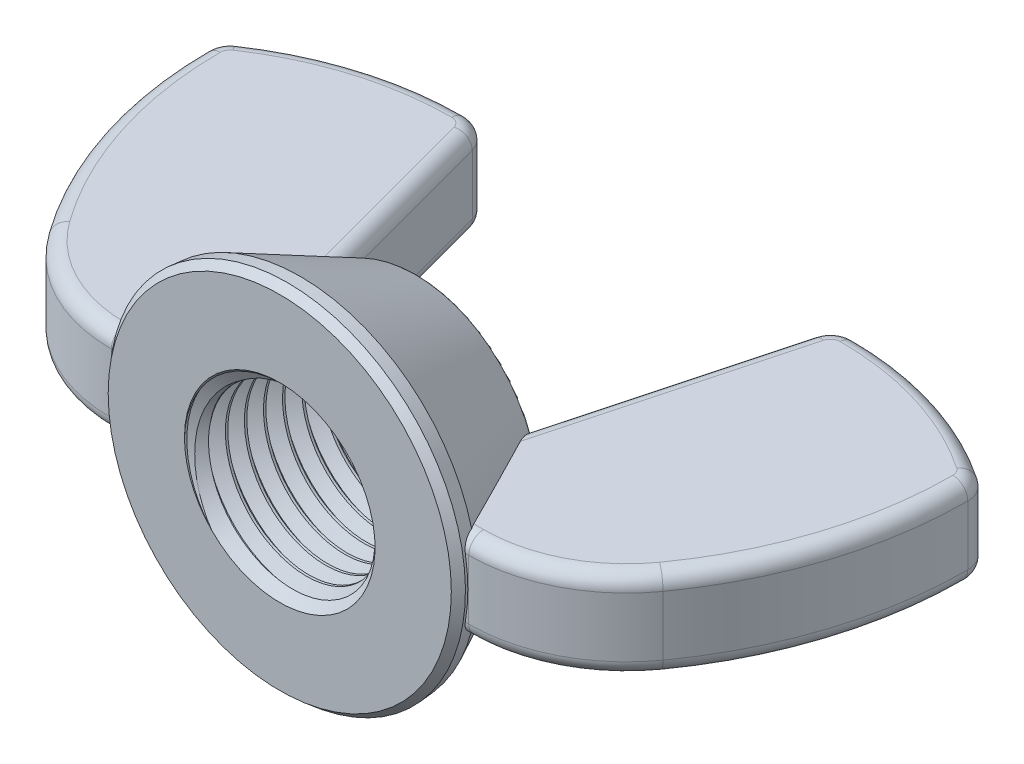
from build123d import *

# Parameters (mm, degrees)
EXTRUDE2_DEPTH     = 2.9765625
SKETCH3_R          = 11.90625
EXTRUDE1_DEPTH     = 1.3716
EXTRUDE1_DRAFT     = -5
SKETCH15_R         = 11.786250549
EXTRUDE3_DEPTH     = 7.7724
EXTRUDE3_TAPER     = 25.897986468
FILLET3_R          = 0.254
SKETCH4_R          = 6.35
CUT_EXTRUDE1_DEPTH = 38.842816875
SWEEP1_PITCH       = 1.27
SKETCH7_R          = 11.90625
CUT_EXTRUDE2_DEPTH = 38.842816907
SKETCH8_R          = 11.786250549
CUT_EXTRUDE3_DEPTH = 33.421849538
SKETCH11_R         = 6.2992
CUT_EXTRUDE5_DEPTH = 33.421849501
CUT_EXTRUDE5_TAPER = 45
CHAMFER1_SIZE      = 0.51435
CHAMFER1_SIZE2     = 0.474777118
FILLET4_R          = 0.9921875


with BuildPart() as part:
    # Sketch13 → Extrude2 (new, symmetric)
    with BuildSketch(Plane(origin=(0, 0, 0), x_dir=(1, 0, 0), z_dir=(0, 1, 0))):
        with BuildLine():
            Line((7.319261591, 0.6858), (11.90625, 0.6858))
            ThreePointArc((11.90625, 0.6858), (16.713759216, 1.84785536), (20.459737622, 5.077431694))
            ThreePointArc((20.459737622, 5.077431694), (24.134569611, 12.373265479), (25.4, 20.443721891))
            ThreePointArc((25.4, 20.443721891), (25.206436775, 21.220061585), (24.671061182, 21.814656418))
            ThreePointArc((24.671061182, 21.814656418), (19.075412555, 24.483643903), (12.94393074, 25.4))
            ThreePointArc((12.94393074, 25.4), (11.937254939, 25.058279612), (11.346631522, 24.174349202))
            Line((11.346631522, 24.174349202), (7.319261591, 9.144))
            Line((7.319261591, 9.144), (7.319261591, 0.6858))
        make_face()
    extrude(amount=EXTRUDE2_DEPTH, both=True)

    # Fillet4
    fillet4_edges = [part.edges().sort_by_distance(p)[0] for p in [
        (16.713759216, 2.9765625, -1.84785536),
        (9.612755795, -2.9765625, -0.6858),
        (24.134569611, 2.9765625, -12.373265479),
        (25.206436775, 2.9765625, -21.220061585),
        (19.075412555, 2.9765625, -24.483643903),
        (11.937254939, 2.9765625, -25.058279612),
        (9.332946556, 2.9765625, -16.659174601),
        (9.612755795, 2.9765625, -0.6858),
        (9.332946556, -2.9765625, -16.659174601),
        (11.937254939, -2.9765625, -25.058279612),
        (19.075412555, -2.9765625, -24.483643903),
        (25.206436775, -2.9765625, -21.220061585),
        (24.134569611, -2.9765625, -12.373265479),
        (16.713759216, -2.9765625, -1.84785536),
    ]]
    fillet(fillet4_edges, radius=FILLET4_R)


with BuildPart() as body_2:
    # Sketch3 → Extrude1 (with draft: the straight prism first)
    with BuildSketch(Plane.XY):
        Circle(SKETCH3_R)
    extrude(amount=-EXTRUDE1_DEPTH)
    # Extrude1: the draft: its side faces are tilted about the plane it starts from
    extrude1_sides = [body_2.faces().sort_by_distance(p)[0] for p in [
        (-11.90625, 0, -0.6858),
    ]]
    draft(extrude1_sides, Plane.XY, EXTRUDE1_DRAFT)

    # Sketch15 → Extrude3 (add)
    with BuildSketch(Plane(origin=(0, 0, -1.3716), x_dir=(-1, 0, 0), z_dir=(0, 0, -1))):
        Circle(SKETCH15_R)
    extrude(amount=EXTRUDE3_DEPTH, taper=EXTRUDE3_TAPER)

    # Fillet3
    fillet3_edges = [body_2.edges().sort_by_distance(p)[0] for p in [
        (8.012513428, 0, -9.144),
    ]]
    fillet(fillet3_edges, radius=FILLET3_R)

    # Sketch4 → Cut-Extrude1 (cut, through all)
    with BuildSketch(Plane.XY):
        Circle(SKETCH4_R)
    extrude(amount=-CUT_EXTRUDE1_DEPTH, mode=Mode.SUBTRACT)

    # Sweep1: arcs per turn and ends read off the stored shape
    # Sweep1: the profile of Sketch6 profile screwed along a right-hand helix through 10 turns, 6 arcs to a turn; built about Z, then put on its axis
    sweep1_z = Axis((0, 0, 0), (0, 0, 1))
    sweep1_corners = [(6.3503, 0, -1.111423205), (5.525110803, 0, -0.635), (5.525110803, 0, -0.47625), (6.3503, 0, 0.000173205)]
    with BuildLine(mode=Mode.PRIVATE) as sweep1_profile:
        Line(sweep1_corners[0], sweep1_corners[1])
        Line(sweep1_corners[1], sweep1_corners[2])
        Line(sweep1_corners[2], sweep1_corners[3])
        Line(sweep1_corners[3], sweep1_corners[0])
    sweep1_cap = Face(sweep1_profile.wire())
    sweep1_turn_angles = [0, 30, 60, 90, 120, 150, 180, 210, 240, 270, 300, 330, 360]
    sweep1_turn_weights = [1, 0.8660254037844387, 1, 0.8660254037844387, 1, 0.8660254037844387, 1, 0.8660254037844387, 1, 0.8660254037844387, 1, 0.8660254037844387, 1]
    sweep1_turn_rails = [Edge.make_bspline([Vector(p[0], p[1], 0).rotate(sweep1_z, sweep1_turn_angles[k]) / sweep1_turn_weights[k] + Vector(0, 0, p[2] + SWEEP1_PITCH * sweep1_turn_angles[k] / 360) for k in range(13)], [0, 0, 0, 1, 1, 2, 2, 3, 3, 4, 4, 5, 5, 6, 6, 6], 2, sweep1_turn_weights) for p in sweep1_corners]
    sweep1_turn_sides = [Face.make_surface_from_curves(sweep1_turn_rails[p[0]], sweep1_turn_rails[p[1]]) for p in [(0, 1), (1, 2), (2, 3), (3, 0)]]
    sweep1_turn = Solid(Shell([*sweep1_turn_sides, sweep1_cap, sweep1_cap.rotate(sweep1_z, 360).moved(Location((0, 0, SWEEP1_PITCH * 360 / 360)))]))
    sweep1_each = [*[sweep1_turn.moved(Location((0, 0, SWEEP1_PITCH * i))) for i in range(10)]]
    add(Plane(origin=(0, 0, 0), x_dir=(-1, 0, 0), z_dir=(0, 0, -1)) * Compound([sweep1_each[i] for i in range(0, 10, 2)]))
    add(Plane(origin=(0, 0, 0), x_dir=(-1, 0, 0), z_dir=(0, 0, -1)) * Compound([sweep1_each[i] for i in range(1, 10, 2)]))

    # Sketch7 → Cut-Extrude2 (cut, through all)
    with BuildSketch(Plane.XY):
        Circle(SKETCH7_R)
    extrude(amount=CUT_EXTRUDE2_DEPTH, mode=Mode.SUBTRACT)

    # Sketch8 → Cut-Extrude3 (cut, through all)
    with BuildSketch(Plane.XY.offset(-9.144)):
        Circle(SKETCH8_R)
    extrude(amount=-CUT_EXTRUDE3_DEPTH, mode=Mode.SUBTRACT)

    # Cut-Extrude4 cone 1 section (through the dimple's axis) → Cut-Extrude4 (revolve, cut)
    with BuildSketch(Plane(origin=(0, 0, 0), x_dir=(0, -1, 0), z_dir=(1, 0, 0))):
        Polygon((0, 0), (6.35, 0), (0, 6.35), align=None)
    revolve(axis=Axis((0, 0, 0), (0, 0, -1)), mode=Mode.SUBTRACT)

    # Sketch11 → Cut-Extrude5 (cut, through all)
    with BuildSketch(Plane.XY.offset(-9.144)):
        Circle(SKETCH11_R)
    extrude(amount=CUT_EXTRUDE5_DEPTH, taper=CUT_EXTRUDE5_TAPER, mode=Mode.SUBTRACT)

    # Chamfer1
    chamfer1_edges = [body_2.edges().sort_by_distance(p)[0] for p in [
        (-11.90625, 0, 0),
    ]]
    chamfer1_side = [body_2.faces().sort_by_distance(p)[0] for p in [
        (-11.846250275, 0, -0.6858),
    ]]
    chamfer(chamfer1_edges, length=CHAMFER1_SIZE, length2=CHAMFER1_SIZE2, reference=chamfer1_side[0])


with BuildPart() as body_3:
    # Mirror6: mirrored copy
    add(part.part.mirror(Plane(origin=(0, 0, 0), x_dir=(0, 0, 1), z_dir=(1, 0, 0))))

    # Combine2: union part, body 2
    add(part.part)
    add(body_2.part)


solid = body_3.part
